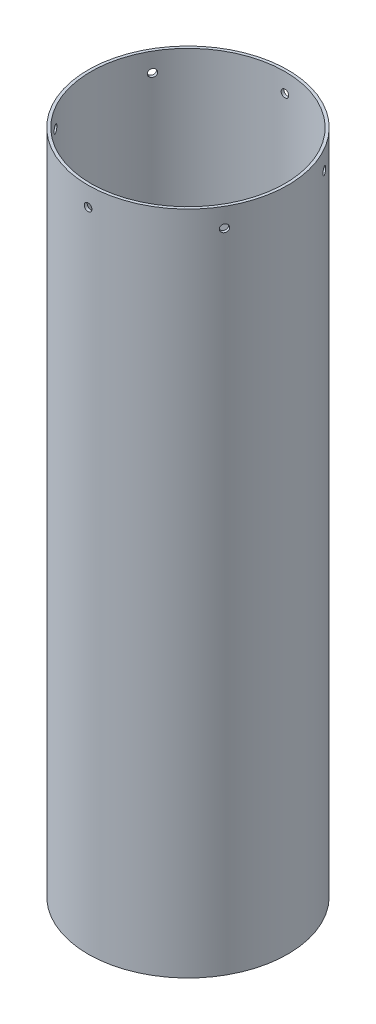
from build123d import *

# Parameters (mm, degrees)
SKETCH_1_R               = 52.5
SKETCH_1_R_2             = 51
EXTRUDE_1_DEPTH          = 350
SKETCH_2_R               = 2
CUT_EXTRUDE_1_DEPTH      = 64
PATTERN_CIRCULAR_1_COUNT = 6


with BuildPart() as part:
    # Эскиз1 → Бобышка-Вытянуть1 (new body)
    with BuildSketch(Plane(origin=(0, 0, 0), x_dir=(1, 0, 0), z_dir=(0, 1, 0))):
        Circle(SKETCH_1_R)
        Circle(SKETCH_1_R_2, mode=Mode.SUBTRACT)
    extrude(amount=EXTRUDE_1_DEPTH)

    # Эскиз2 → Вырез-Вытянуть1 (cut)
    with BuildSketch(Plane.XY):
        with Locations((0, 340)):
            Circle(SKETCH_2_R)
    cut_extrude_1 = extrude(amount=CUT_EXTRUDE_1_DEPTH, mode=Mode.SUBTRACT)

    # Круговой массив1: Вырез-Вытянуть1 ×6 about axis
    pattern_circular_1_axis = Axis((0, 350, 0), (0, -1, 0))
    for i in range(1, PATTERN_CIRCULAR_1_COUNT):
        add(cut_extrude_1.rotate(pattern_circular_1_axis, i * 360 / PATTERN_CIRCULAR_1_COUNT), mode=Mode.SUBTRACT)


solid = part.part
